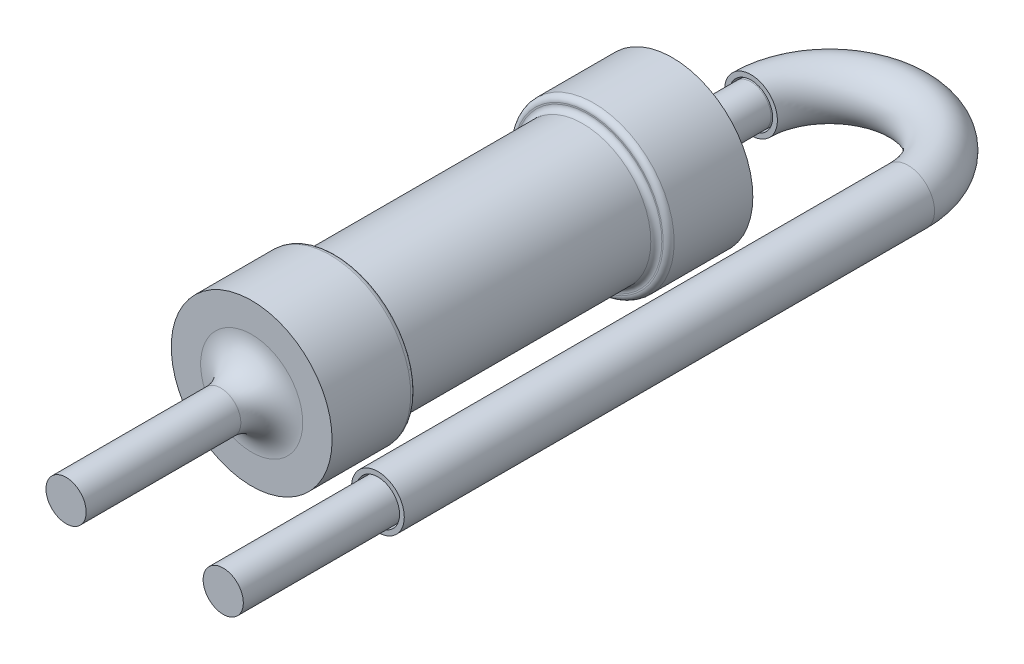
from build123d import *

# Parameters (mm, degrees)
SKETCH1_R           = 1.3
BOSS_EXTRUDE1_DEPTH = 1.36
SKETCH2_R           = 1.1
BOSS_EXTRUDE2_DEPTH = 4.08
SKETCH3_R           = 1.3
BOSS_EXTRUDE3_DEPTH = 1.36
SKETCH4_R           = 0.325
BOSS_EXTRUDE4_DEPTH = 1.27
BOSS_EXTRUDE5_START = 3
SKETCH5_R           = 0.325
BOSS_EXTRUDE5_DEPTH = 3
FILLET1_R           = 0.5
FILLET2_R           = 0.0889
SWEEP1_OUTLINE_R    = 0.325
SWEEP1_ANGLE        = 180
SWEEP1_START        = -4.67
SWEEP1_2_OUTLINE_R  = 0.325
SWEEP1_2_DEPTH      = 11.07
SKETCH9_R           = 0.4266
SKETCH9_R_2         = 0.3504


with BuildPart() as part:
    # Sketch1 → Boss-Extrude1 (new body)
    with BuildSketch(Plane(origin=(0, 0, -3.4), x_dir=(-1, 0, 0), z_dir=(0, 0, -1))):
        with Locations(Location((0, 0, 0), (0, 0, 180))):
            Circle(SKETCH1_R)
    extrude(amount=-BOSS_EXTRUDE1_DEPTH)

    # Sketch2 → Boss-Extrude2 (add)
    with BuildSketch(Plane.XY.offset(-2.04)):
        Circle(SKETCH2_R)
    extrude(amount=BOSS_EXTRUDE2_DEPTH)

    # Sketch3 → Boss-Extrude3 (add)
    with BuildSketch(Plane(origin=(0, 0, 2.04), x_dir=(-1, 0, 0), z_dir=(0, 0, -1))):
        with Locations(Location((0, 0, 0), (0, 0, 180))):
            Circle(SKETCH3_R)
    extrude(amount=-BOSS_EXTRUDE3_DEPTH)

    # Sketch4 → Boss-Extrude4 (add)
    with BuildSketch(Plane(origin=(0, 0, -3.4), x_dir=(-1, 0, 0), z_dir=(0, 0, -1))):
        Circle(SKETCH4_R)
    extrude(amount=BOSS_EXTRUDE4_DEPTH)

    # Sketch5 → Boss-Extrude5 (add)
    with BuildSketch(Plane.XY.offset(3.4).offset(BOSS_EXTRUDE5_START)):
        with Locations(Location((0, 0, 0), (0, 0, 180))):
            Circle(SKETCH5_R)
    extrude(amount=-BOSS_EXTRUDE5_DEPTH)

    # Fillet1
    fillet1_edges = [part.edges().sort_by_distance(p)[0] for p in [
        (0.325, 0, -3.4),
        (0.325, 0, 3.4),
    ]]
    fillet(fillet1_edges, radius=FILLET1_R)

    # Fillet2
    fillet2_edges = [part.edges().sort_by_distance(p)[0] for p in [
        (-1.3, 0, 2.04),
        (-1.3, 0, -2.04),
        (-1.1, 0, -2.04),
        (-1.1, 0, 2.04),
    ]]
    fillet(fillet2_edges, radius=FILLET2_R)

    # Sweep1: read off the stored shape, not the designer's step
    # Sweep1 outline → Sweep1 (revolve)
    with BuildSketch(Plane(origin=(1.27, 0, -4.67), x_dir=(1, 0, 0), z_dir=(0, 0, 1))):
        with Locations((1.27, 0)):
            Circle(SWEEP1_OUTLINE_R)
    revolve(axis=Axis((1.27, 0, -4.67), (0, 1, 0)), revolution_arc=SWEEP1_ANGLE)

    # Sweep1 2 outline → Sweep1 2 (add)
    with BuildSketch(Plane.XY.offset(SWEEP1_START)):
        with Locations((2.54, 0)):
            Circle(SWEEP1_2_OUTLINE_R)
    extrude(amount=SWEEP1_2_DEPTH)


with BuildPart() as body_2:
    # Sweep2: sweep along a path in Sketch8<2>
    with BuildLine(Plane(origin=(0, 0, 0), x_dir=(1, 0, 0), z_dir=(0, 1, 0))) as sweep2_path:
        Line((2.54, -3.9), (2.54, 4.67))
        ThreePointArc((2.54, 4.67), (1.27, 5.94), (0, 4.67))
    # Sketch9 → Sweep2 (sweep)
    with BuildSketch(Plane.XY.offset(3.9)):
        with Locations((2.54, 0)):
            Circle(SKETCH9_R)
        with Locations((2.54, 0)):
            Circle(SKETCH9_R_2, mode=Mode.SUBTRACT)
    sweep(path=sweep2_path.line)


solid = Compound([part.part, body_2.part])
